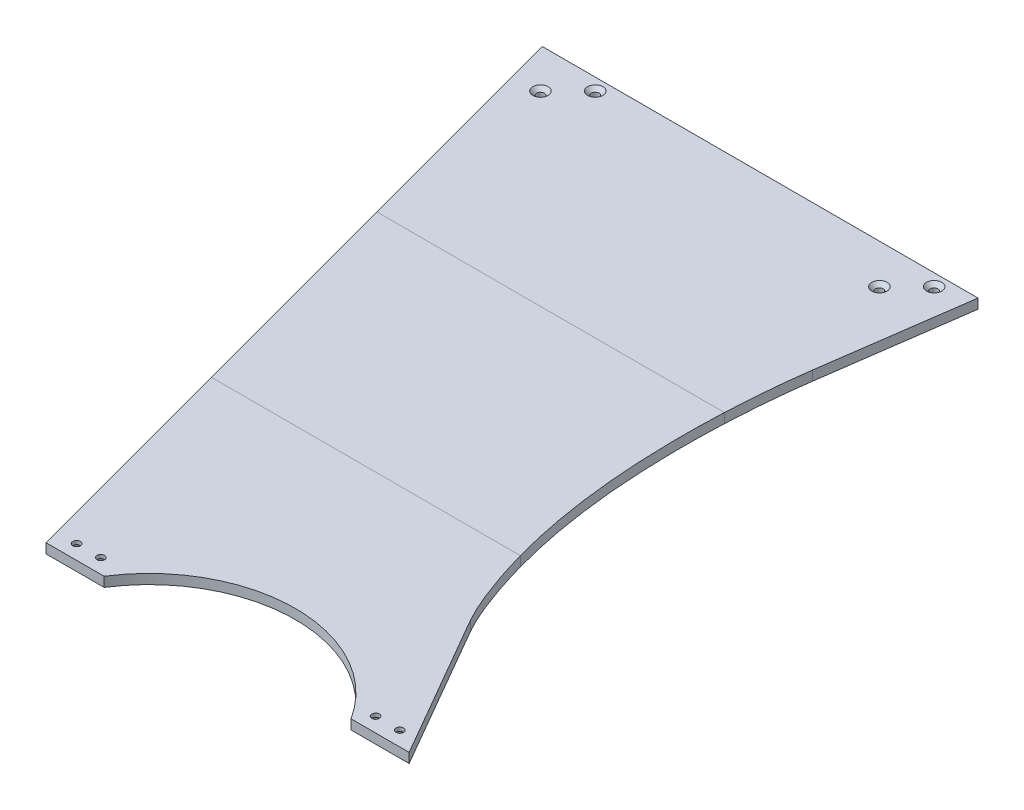
from build123d import *

# Parameters (mm, degrees)
BOSS_EXTRUDE1_DEPTH                             = 4
CSK_FOR_M3_FLAT_HEAD_MACHINE_SCREW1_D           = 3.2
CSK_FOR_M3_FLAT_HEAD_MACHINE_SCREW1_CSINK_D     = 6.3
CSK_FOR_M3_FLAT_HEAD_MACHINE_SCREW1_CSINK_ANGLE = 90
TAP_DRILL_FOR_M3_HELICOIL1_D                    = 3.15
CUT_EXTRUDE2_DEPTH                              = 2.5
SPLIT1_OUTLINE_W                                = 182
SPLIT1_OUTLINE_H                                = 4
SPLIT1_DEPTH                                    = 186.66666666
SPLIT1_2_OUTLINE_R                              = 1.6
SPLIT1_2_DEPTH                                  = 2.4499999
SPLIT1_START                                    = 2.4499999
SPLIT1_3_DEPTH                                  = 1.5500001
SPLIT1_8_DEPTH                                  = 4


with BuildPart() as part:
    # Sketch1 → Boss-Extrude1 (new body)
    with BuildSketch(Plane(origin=(0, 0, 0), x_dir=(1, 0, 0), z_dir=(0, 1, 0))):
        with BuildLine():
            Line((81.567549918, -60), (90, 0))
            Line((90, 0), (-90, 0))
            Line((-90, 0), (-14.974226119, -280))
            Line((-14.974226119, -280), (9.025773881, -280))
            ThreePointArc((9.025773881, -280), (60.025773881, -252), (111.025773881, -280))
            Line((111.025773881, -280), (135.025773881, -280))
            Line((135.025773881, -280), (100.384757729, -220))
            add(Edge.make_bspline(
                [(100.384757729, -220), (95.344051169, -211.269240132), (73.389005734, -150.758031654), (78.220675853, -83.814246385), (81.567549918, -60)],
                knots=[0, 0, 0, 0, 0.285189486, 1, 1, 1, 1], degree=3))
        make_face()
    extrude(amount=BOSS_EXTRUDE1_DEPTH)

    # CSK for M3 Flat Head Machine Screw1 (through all)
    with Locations(Plane(origin=(0, 4, 0), x_dir=(1, 0, 0), z_dir=(0, 1, 0))):
        with Locations((-74.416095469, -16.313708499), (-63.10238697, -5), (65.583904531, -16.313708499), (76.89761303, -5)):
            CounterSinkHole(CSK_FOR_M3_FLAT_HEAD_MACHINE_SCREW1_D / 2, CSK_FOR_M3_FLAT_HEAD_MACHINE_SCREW1_CSINK_D / 2, counter_sink_angle=CSK_FOR_M3_FLAT_HEAD_MACHINE_SCREW1_CSINK_ANGLE)

    # Tap Drill for M3 Helicoil1 (through all)
    with Locations(Plane(origin=(0, 4, 0), x_dir=(1, 0, 0), z_dir=(0, 1, 0))):
        with Locations((-8.329810717, -274), (1.670189283, -274), (125.15946328, -274), (115.15946328, -274)):
            Hole(TAP_DRILL_FOR_M3_HELICOIL1_D / 2)

    # Sketch13 → Cut-Extrude2 (cut)
    with BuildSketch(Plane(origin=(0, 0, 0), x_dir=(-1, 0, 0), z_dir=(0, -1, 0))):
        Polygon((-113.485147499, -276.9), (-111.810831718, -274), (-113.485147499, -271.1), (-116.83377906, -271.1), (-118.508094841, -274), (-116.83377906, -276.9), align=None)
        Polygon((-123.485147499, -276.9), (-121.810831718, -274), (-123.485147499, -271.1), (-126.83377906, -271.1), (-128.508094841, -274), (-126.83377906, -276.9), align=None)
        Polygon((10.004126498, -276.9), (11.678442278, -274), (10.004126498, -271.1), (6.655494936, -271.1), (4.981179156, -274), (6.655494936, -276.9), align=None)
        Polygon((0.004126498, -276.9), (1.678442278, -274), (0.004126498, -271.1), (-3.344505064, -271.1), (-5.018820844, -274), (-3.344505064, -276.9), align=None)
    extrude(amount=-CUT_EXTRUDE2_DEPTH, mode=Mode.SUBTRACT)

    # Split1: read off the stored shape, not the designer's step
    # Split1 outline → Split1 (cut)
    with BuildSketch(Plane.XY):
        with Locations((0, 2)):
            Rectangle(SPLIT1_OUTLINE_W, SPLIT1_OUTLINE_H)
    extrude(amount=SPLIT1_DEPTH, mode=Mode.SUBTRACT)


with BuildPart() as body_2:
    # Split1 2 outline → Split1 2 (new body)
    with BuildSketch(Plane(origin=(0, 0, 0), x_dir=(1, 0, 0), z_dir=(0, 1, 0))):
        with BuildLine():
            Line((-64.991408707, -93.33333333), (78.575108831, -93.33333333))
            add(Edge.make_bspline(
                [(78.575108831, -93.33333333), (79.171445332, -79.99826686), (80.376266468, -68.476422189), (81.567549918, -60)],
                knots=[0.745570966, 0.745570966, 0.745570966, 0.745570966, 1, 1, 1, 1], degree=3))
            Line((81.567549918, -60), (90, 0))
            Line((90, 0), (-90, 0))
            Line((-90, 0), (-64.991408707, -93.33333333))
        make_face()
        with Locations((-74.416095469, -16.313708499)):
            Circle(SPLIT1_2_OUTLINE_R, mode=Mode.SUBTRACT)
        with Locations((-63.10238697, -5)):
            Circle(SPLIT1_2_OUTLINE_R, mode=Mode.SUBTRACT)
        with Locations((65.583904531, -16.313708499)):
            Circle(SPLIT1_2_OUTLINE_R, mode=Mode.SUBTRACT)
        with Locations((76.89761303, -5)):
            Circle(SPLIT1_2_OUTLINE_R, mode=Mode.SUBTRACT)
    extrude(amount=SPLIT1_2_DEPTH)

    # Split1 3 outline → Split1 3 (add)
    with BuildSketch(Plane(origin=(0, 0, 0), x_dir=(1, 0, 0), z_dir=(0, 1, 0)).offset(SPLIT1_START)):
        with BuildLine():
            Line((-64.991408707, -93.33333333), (78.575108831, -93.33333333))
            add(Edge.make_bspline(
                [(78.575108831, -93.33333333), (79.171445332, -79.99826686), (80.376266468, -68.476422189), (81.567549918, -60)],
                knots=[0.745570966, 0.745570966, 0.745570966, 0.745570966, 1, 1, 1, 1], degree=3))
            Line((81.567549918, -60), (90, 0))
            Line((90, 0), (-90, 0))
            Line((-90, 0), (-64.991408707, -93.33333333))
        make_face()
    extrude(amount=SPLIT1_3_DEPTH)

    # Split1 4: loft between two sections, ruled curve by curve
    split1_4_from = [
        Edge.make_three_point_arc((76.89761303, 2.45, 6.6), (78.49761303, 2.45, 5), (76.89761303, 2.45, 3.4)),
        Edge.make_three_point_arc((76.89761303, 2.45, 3.4), (75.29761303, 2.45, 5), (76.89761303, 2.45, 6.6)),
    ]
    split1_4_to = [
        Edge.make_three_point_arc((76.89761303, 4, 8.15), (80.04761303, 4, 5), (76.89761303, 4, 1.85)),
        Edge.make_three_point_arc((76.89761303, 4, 1.85), (73.74761303, 4, 5), (76.89761303, 4, 8.15)),
    ]
    split1_4 = Solid(Shell([*[Face.make_surface_from_curves(split1_4_from[k], split1_4_to[k]) for k in range(2)], Face(Wire(split1_4_from)), Face(Wire(split1_4_to))]))
    add(split1_4, mode=Mode.SUBTRACT)

    # Split1 5: loft between two sections, ruled curve by curve
    split1_5_from = [
        Edge.make_three_point_arc((65.583904531, 2.45, 17.913708499), (67.183904531, 2.45, 16.313708499), (65.583904531, 2.45, 14.713708499)),
        Edge.make_three_point_arc((65.583904531, 2.45, 14.713708499), (63.983904531, 2.45, 16.313708499), (65.583904531, 2.45, 17.913708499)),
    ]
    split1_5_to = [
        Edge.make_three_point_arc((65.583904531, 4, 19.463708499), (68.733904531, 4, 16.313708499), (65.583904531, 4, 13.163708499)),
        Edge.make_three_point_arc((65.583904531, 4, 13.163708499), (62.433904531, 4, 16.313708499), (65.583904531, 4, 19.463708499)),
    ]
    split1_5 = Solid(Shell([*[Face.make_surface_from_curves(split1_5_from[k], split1_5_to[k]) for k in range(2)], Face(Wire(split1_5_from)), Face(Wire(split1_5_to))]))
    add(split1_5, mode=Mode.SUBTRACT)

    # Split1 6: loft between two sections, ruled curve by curve
    split1_6_from = [
        Edge.make_three_point_arc((-63.10238697, 2.45, 6.6), (-61.50238697, 2.45, 5), (-63.10238697, 2.45, 3.4)),
        Edge.make_three_point_arc((-63.10238697, 2.45, 3.4), (-64.70238697, 2.45, 5), (-63.10238697, 2.45, 6.6)),
    ]
    split1_6_to = [
        Edge.make_three_point_arc((-63.10238697, 4, 8.15), (-59.95238697, 4, 5), (-63.10238697, 4, 1.85)),
        Edge.make_three_point_arc((-63.10238697, 4, 1.85), (-66.25238697, 4, 5), (-63.10238697, 4, 8.15)),
    ]
    split1_6 = Solid(Shell([*[Face.make_surface_from_curves(split1_6_from[k], split1_6_to[k]) for k in range(2)], Face(Wire(split1_6_from)), Face(Wire(split1_6_to))]))
    add(split1_6, mode=Mode.SUBTRACT)

    # Split1 7: loft between two sections, ruled curve by curve
    split1_7_from = [
        Edge.make_three_point_arc((-74.416095469, 2.45, 17.913708499), (-72.816095469, 2.45, 16.313708499), (-74.416095469, 2.45, 14.713708499)),
        Edge.make_three_point_arc((-74.416095469, 2.45, 14.713708499), (-76.016095469, 2.45, 16.313708499), (-74.416095469, 2.45, 17.913708499)),
    ]
    split1_7_to = [
        Edge.make_three_point_arc((-74.416095469, 4, 19.463708499), (-71.266095469, 4, 16.313708499), (-74.416095469, 4, 13.163708499)),
        Edge.make_three_point_arc((-74.416095469, 4, 13.163708499), (-77.566095469, 4, 16.313708499), (-74.416095469, 4, 19.463708499)),
    ]
    split1_7 = Solid(Shell([*[Face.make_surface_from_curves(split1_7_from[k], split1_7_to[k]) for k in range(2)], Face(Wire(split1_7_from)), Face(Wire(split1_7_to))]))
    add(split1_7, mode=Mode.SUBTRACT)


with BuildPart() as body_3:
    # Split1 8 outline → Split1 8 (new body)
    with BuildSketch(Plane(origin=(0, 0, 0), x_dir=(1, 0, 0), z_dir=(0, 1, 0))):
        with BuildLine():
            Line((-39.982817415, -186.66666666), (87.654154717, -186.66666666))
            add(Edge.make_bspline(
                [(87.654154717, -186.66666666), (86.701649765, -183.250236687), (78.52127075, -151.215603108), (77.496056347, -117.462724315), (78.575108831, -93.33333333)],
                knots=[0.228738149, 0.228738149, 0.228738149, 0.228738149, 0.285189486, 0.745570966, 0.745570966, 0.745570966, 0.745570966], degree=3))
            Line((78.575108831, -93.33333333), (-64.991408707, -93.33333333))
            Line((-64.991408707, -93.33333333), (-39.982817415, -186.66666666))
        make_face()
    extrude(amount=SPLIT1_8_DEPTH)


solid = Compound([part.part, body_2.part, body_3.part])
